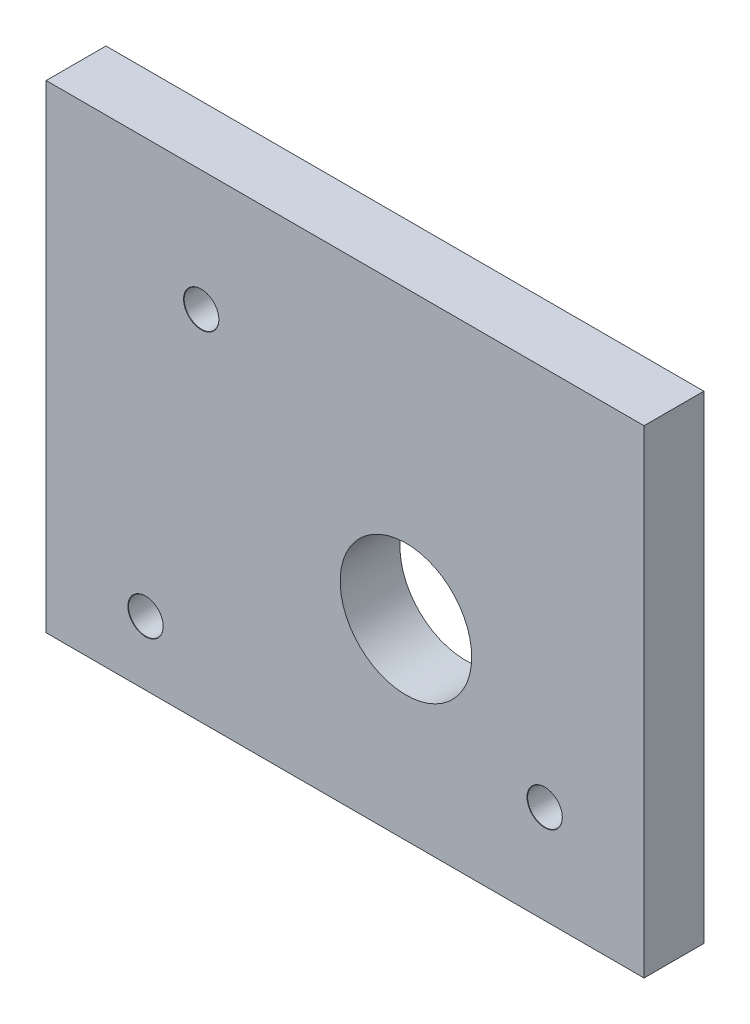
from build123d import *

# Parameters (mm, degrees)
SKETCH1_W                        = 50
SKETCH1_H                        = 40
BOSS_EXTRUDE1_DEPTH              = 2.5
M2_5_CLEARANCE_HOLE2_D           = 2.9
M2_5_CLEARANCE_HOLE2_CSINK_D     = 2.95
M2_5_CLEARANCE_HOLE2_CSINK_ANGLE = 90
SKETCH4_R                        = 5.5
CUT_EXTRUDE1_DEPTH               = 55.441590725


with BuildPart() as part:
    # Sketch1 → Boss-Extrude1 (new, symmetric)
    with BuildSketch(Plane.XY):
        with Locations((16.688846575, 14.654391813)):
            Rectangle(SKETCH1_W, SKETCH1_H)
    extrude(amount=BOSS_EXTRUDE1_DEPTH, both=True)

    # M2.5 Clearance Hole2 (through all)
    with Locations(Plane.XY.offset(2.5)):
        with Locations((4.655068225, 24.562783633), (33.37769315, 2.86), (0, 0)):
            CounterSinkHole(M2_5_CLEARANCE_HOLE2_D / 2, M2_5_CLEARANCE_HOLE2_CSINK_D / 2, counter_sink_angle=M2_5_CLEARANCE_HOLE2_CSINK_ANGLE)

    # Sketch4 → Cut-Extrude1 (cut, through all)
    with BuildSketch(Plane.XY.offset(2.5)):
        with Locations((21.775361697, 10.694915753)):
            Circle(SKETCH4_R)
    extrude(amount=-CUT_EXTRUDE1_DEPTH, mode=Mode.SUBTRACT)


solid = part.part
